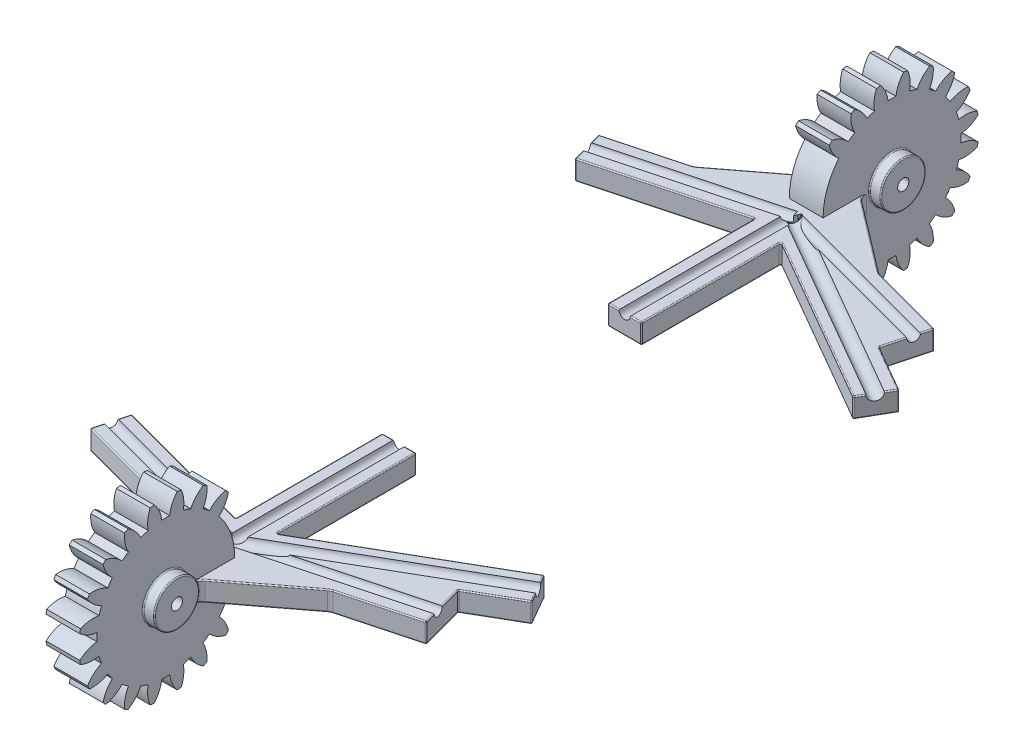
from build123d import *

# Parameters (mm, degrees)
BASPROSKE_W         = 3
BASPROSKE_H         = 7.7
TOOTHCUT_DEPTH      = 12.295131695
TEETHCUTS_COUNT     = 20
TEETHCUTS_ANGLE     = 342
BORSKE_R            = 0.5
BORE_DEPTH          = 50.0000508
CUT_EXTRUDE_1_DEPTH = 12.201503695
EXTRUDE_1_DEPTH     = 1.75
EXTRUDE_3_DEPTH     = 3
EXTRUDE_5_DEPTH     = 1.75
FILLET_4_R          = 0.1
FILLET_6_R          = 1
FILLET_7_R          = 1
FILLET_8_R          = 1
FILLET_9_R          = 0.1
FILLET_10_R         = 0.1
SKETCH_14_R         = 2
SKETCH_14_R_2       = 0.5
EXTRUDE_7_DEPTH     = 1
EXTRUDE_START       = 1
SKETCH_15_R         = 2
SKETCH_15_R_2       = 0.5
EXTRUDE_8_DEPTH     = 1
FILLET_11_R         = 0.1
FILLET_12_R         = 0.1
FILLET_13_R         = 0.1
SKETCH_9_R          = 0.5
CUT_EXTRUDE_2_DEPTH = 15
SKETCH_10_R         = 0.5
CUT_EXTRUDE_3_DEPTH = 15
SKETCH_16_R         = 0.6
CUT_EXTRUDE_4_DEPTH = 20
SKETCH_17_R         = 0.5
CUT_EXTRUDE_5_DEPTH = 15
FILLET_14_R         = 0.1


with BuildPart() as part:
    # BasProSke → Base-Revolve (revolve)
    with BuildSketch(Plane(origin=(0, 0, 0), x_dir=(1, 0, 0), z_dir=(0, 1, 0)), mode=Mode.PRIVATE) as base_revolve_sk:
        with Locations((1.5, 3.85)):
            Rectangle(BASPROSKE_W, BASPROSKE_H)
    revolve(base_revolve_sk.sketch.rotate(Axis((-10, 0, 0), (1, 0, 0)), 180), axis=Axis((-10, 0, 0), (1, 0, 0)))

    # TooCutSke → ToothCut (cut, through all)
    with BuildSketch(Plane(origin=(0, 0, 0), x_dir=(0, 0, -1), z_dir=(1, 0, 0))):
        with BuildLine():
            ThreePointArc((0.350524468, 6.11396014), (0, 6.124), (-0.350524468, 6.11396014))
            ThreePointArc((-0.350524468, 6.11396014), (-0.579534642, 6.937844235), (-1.04652851, 7.654187301))
            ThreePointArc((-1.04652851, 7.654187301), (0, 7.7254), (1.04652851, 7.654187301))
            ThreePointArc((1.04652851, 7.654187301), (0.579534642, 6.937844235), (0.350524468, 6.11396014))
        make_face()
    toothcut = extrude(amount=TOOTHCUT_DEPTH, mode=Mode.SUBTRACT)

    # TeethCuts: ToothCut ×20 about axis
    teethcuts_axis = Axis((-10, 0, 0), (1, 0, 0))
    for i in range(1, TEETHCUTS_COUNT):
        add(toothcut.rotate(teethcuts_axis, i * TEETHCUTS_ANGLE / (TEETHCUTS_COUNT - 1)), mode=Mode.SUBTRACT)

    # BorSke → Bore (cut, symmetric)
    with BuildSketch(Plane(origin=(0, 0, 0), x_dir=(0, 0, -1), z_dir=(1, 0, 0))):
        with Locations(Location((0, 0, 0), (0, 0, 180))):
            Circle(BORSKE_R)
    extrude(amount=BORE_DEPTH, both=True, mode=Mode.SUBTRACT)

    # 草图1 → 切除-拉伸1 (cut, through all)
    with BuildSketch(Plane(origin=(3, 0, 0), x_dir=(0, 0, -1), z_dir=(1, 0, 0))):
        with BuildLine():
            Line((4.954420074, 3.599596885), (6.32952333, 4.598667881))
            ThreePointArc((6.32952333, 4.598667881), (7.80058054, 0), (6.32952333, -4.598667881))
            Line((6.32952333, -4.598667881), (4.954420074, -3.599596885))
            ThreePointArc((4.954420074, -3.599596885), (6.124, 0), (4.954420074, 3.599596885))
        make_face()
    extrude(amount=-CUT_EXTRUDE_1_DEPTH, mode=Mode.SUBTRACT)

    # 草图3 → 凸台-拉伸1 (add)
    with BuildSketch(Plane(origin=(0, 0, 0), x_dir=(1, 0, 0), z_dir=(0, 1, 0))):
        Polygon((0, 6.093222374), (3, 6.093222374), (3, 6.094937651), (16.444767752, 9.697452313), (15.413748512, 13.545268498), (19.570508076, 15.945174751), (18.070508076, 18.543250962), (3, 9.842289068), (3, 22.244212856), (0, 22.244212856), (0, 9.199050916), (-12.600658827, 12.575387272), (-13.377115962, 9.677609793), align=None)
    extrude(amount=-EXTRUDE_1_DEPTH)

    # 草图4 → 凸台-拉伸3 (add)
    with BuildSketch(Plane.ZY):
        with BuildLine():
            Line((-6.093222374, 0), (-6.093222374, -1.75))
            Line((-6.093222374, -1.75), (-5.657265567, -2.344935458))
            ThreePointArc((-5.657265567, -2.344935458), (-5.880404131, -1.173427076), (-6.093222374, 0))
        make_face()
    extrude(amount=-EXTRUDE_3_DEPTH)

    # 草图6 → 凸台-拉伸5 (add)
    with BuildSketch(Plane(origin=(0, 0, 0), x_dir=(1, 0, 0), z_dir=(0, 1, 0))):
        Polygon((9.722383876, 7.896194982), (3, 2.778448376), (3, 6.094937651), align=None)
        Polygon((0, 2.778448376), (-6.688557981, 7.885416084), (0, 6.093222374), align=None)
    extrude(amount=-EXTRUDE_5_DEPTH)

    # 圆角4
    fillet_4_edges = [part.edges().sort_by_distance(p)[0] for p in [
        (15.929258132, 0, -11.621360405),
        (17.492128294, 0, -14.745221624),
        (18.820508076, 0, -17.244212856),
        (1.5, 0, -22.244212856),
        (-12.988887394, 0, -11.126498533),
        (-12.600658827, -0.875, -12.575387272),
        (1.5, -1.75, -22.244212856),
        (0, -0.875, -22.244212856),
        (3, -0.875, -22.244212856),
        (18.820508076, -1.75, -17.244212856),
        (18.070508076, -0.875, -18.543250962),
        (17.492128294, -1.75, -14.745221624),
        (19.570508076, -0.875, -15.945174751),
        (15.929258132, -1.75, -11.621360405),
        (15.413748512, -0.875, -13.545268498),
        (16.444767752, -0.875, -9.697452313),
        (-12.988887394, -1.75, -11.126498533),
        (-13.377115962, -0.875, -9.677609793),
    ]]
    fillet(fillet_4_edges, radius=FILLET_4_R)

    # 圆角6
    fillet_6_edges = [part.edges().sort_by_distance(p)[0] for p in [
        (9.722383876, -0.875, -7.896194982),
    ]]
    fillet(fillet_6_edges, radius=FILLET_6_R)

    # 圆角7
    fillet_7_edges = [part.edges().sort_by_distance(p)[0] for p in [
        (3, -0.875, -2.778448376),
    ]]
    fillet(fillet_7_edges, radius=FILLET_7_R)

    # 圆角8
    fillet_8_edges = [part.edges().sort_by_distance(p)[0] for p in [
        (0, -0.875, -2.778448376),
        (-6.688557981, -0.875, -7.885416084),
    ]]
    fillet(fillet_8_edges, radius=FILLET_8_R)

    # 圆角9
    # the kernel refuses this fillet: 0.1 mm, written as the material it takes off along each edge
    with BuildSketch(Plane(origin=(-13.254641475, -1.65, -9.748320472), x_dir=(-0.25881904510251724, 0, 0.9659258262890693), z_dir=(0, -1, 0))) as fillet_9_piece_1_section:
        Polygon((0, 0), (FILLET_9_R * 1.02, 0), (FILLET_9_R * 1.02, FILLET_9_R * 1.02), (0, FILLET_9_R * 1.02), align=None)
    fillet_9_piece_1 = extrude(amount=FILLET_9_R * 1.02, mode=Mode.PRIVATE)
    fillet_9_piece_1 = fillet_9_piece_1 - Plane(origin=(-13.254641475, -1.65, -9.748320472), x_dir=(0.8660254037844369, 0, -0.500000000000003), z_dir=(0, -1, 0)) * Sphere(FILLET_9_R, mode=Mode.PRIVATE)
    add(fillet_9_piece_1, mode=Mode.SUBTRACT)
    with BuildSketch(Plane(origin=(-13.254641475, -0.1, -9.748320472), x_dir=(-0.25881904510251724, 0, 0.9659258262890693), z_dir=(0, 1, 0))) as fillet_9_piece_2_section:
        Polygon((0, 0), (FILLET_9_R * 1.02, 0), (FILLET_9_R * 1.02, -FILLET_9_R * 1.02), (0, -FILLET_9_R * 1.02), align=None)
    fillet_9_piece_2 = extrude(amount=FILLET_9_R * 1.02, mode=Mode.PRIVATE)
    fillet_9_piece_2 = fillet_9_piece_2 - Plane(origin=(-13.254641475, -0.1, -9.748320472), x_dir=(0.8660254037844369, 0, -0.500000000000003), z_dir=(0, 1, 0)) * Sphere(FILLET_9_R, mode=Mode.PRIVATE)
    add(fillet_9_piece_2, mode=Mode.SUBTRACT)
    with BuildSketch(Plane(origin=(-13.280523379, -1.75, -9.651727889), x_dir=(0.2588190451025172, 0, -0.9659258262890692), z_dir=(0.9659258262890693, 0, 0.25881904510251724))) as fillet_9_piece_3:
        with BuildLine():
            CenterArc((FILLET_9_R, FILLET_9_R), FILLET_9_R, 180, 90)
            Line((0, FILLET_9_R), (0, 0))
            Line((0, 0), (FILLET_9_R, 0))
        make_face()
    extrude(amount=6.626833982, mode=Mode.SUBTRACT)
    with BuildSketch(Plane(origin=(-13.280523379, 0, -9.651727889), x_dir=(0.2588190451025172, 0, -0.9659258262890692), z_dir=(0.9659258262890693, 0, 0.25881904510251724))) as fillet_9_piece_4:
        with BuildLine():
            CenterArc((FILLET_9_R, -FILLET_9_R), FILLET_9_R, 90, 90)
            Line((0, -FILLET_9_R), (0, 0))
            Line((0, 0), (FILLET_9_R, 0))
        make_face()
    extrude(amount=6.626833982, mode=Mode.SUBTRACT)
    with BuildSketch(Plane(origin=(-0.393135816, 0, -3.078622483), x_dir=(0.6068641836157859, 0, -0.7948055502098269), z_dir=(-0.7948055502098269, 0, -0.606864183615786))) as fillet_9_piece_5:
        with BuildLine():
            CenterArc((FILLET_9_R, FILLET_9_R), FILLET_9_R, 180, 90)
            Line((0, FILLET_9_R), (0, 0))
            Line((0, 0), (FILLET_9_R, 0))
        make_face()
    extrude(amount=7.723036575, mode=Mode.SUBTRACT)
    with BuildSketch(Plane(origin=(-0.393135816, -1.75, -3.078622483), x_dir=(0.6068641836157859, 0, -0.7948055502098269), z_dir=(-0.7948055502098269, 0, -0.606864183615786))) as fillet_9_piece_6:
        with BuildLine():
            CenterArc((FILLET_9_R, -FILLET_9_R), FILLET_9_R, 90, 90)
            Line((0, -FILLET_9_R), (0, 0))
            Line((0, 0), (FILLET_9_R, 0))
        make_face()
    extrude(amount=7.723036575, mode=Mode.SUBTRACT)
    with BuildSketch(Plane(origin=(-7.138312334, 0, -6.970651219), x_dir=(0.2588190451025182, 0, -0.965925826289069), z_dir=(-0.965925826289069, 0, -0.2588190451025182))) as fillet_9_piece_7:
        with BuildLine():
            CenterArc((1 + FILLET_9_R, FILLET_9_R), FILLET_9_R, 180, 90)
            Line((1, FILLET_9_R), (1, 0))
            Line((1, 0), (1 + FILLET_9_R, 0))
        make_face()
    revolve(axis=Axis((-7.138312334, 0, -6.970651219), (0, -1, 0)), revolution_arc=22.363106768, mode=Mode.SUBTRACT)
    with BuildSketch(Plane(origin=(-7.138312334, -1.75, -6.970651219), x_dir=(0.2588190451025182, 0, -0.965925826289069), z_dir=(-0.965925826289069, 0, -0.2588190451025182))) as fillet_9_piece_8:
        with BuildLine():
            CenterArc((1 + FILLET_9_R, -FILLET_9_R), FILLET_9_R, 90, 90)
            Line((1, -FILLET_9_R), (1, 0))
            Line((1, 0), (1 + FILLET_9_R, 0))
        make_face()
    revolve(axis=Axis((-7.138312334, -1.75, -6.970651219), (0, -1, 0)), revolution_arc=22.363106768, mode=Mode.SUBTRACT)
    with BuildSketch(Plane(origin=(-1, 0, -2.283816933), x_dir=(0.6068641836157861, 0, -0.7948055502098269), z_dir=(-0.7948055502098269, 0, -0.6068641836157861))) as fillet_9_piece_9_section:
        with BuildLine():
            CenterArc((1 + FILLET_9_R, FILLET_9_R), FILLET_9_R, 180, 90)
            Line((1, FILLET_9_R), (1, 0))
            Line((1, 0), (1 + FILLET_9_R, 0))
        make_face()
    fillet_9_piece_9 = revolve(axis=Axis((-1, 0, -2.283816933), (0, -1, 0)), revolution_arc=66.962805944, mode=Mode.PRIVATE)
    fillet_9_piece_9 = split(fillet_9_piece_9, bisect_by=Plane(origin=(0, -0.016628304, -3.022660808), z_dir=(-1, 0, 0)), keep=Keep.TOP, mode=Mode.PRIVATE)
    add(fillet_9_piece_9, mode=Mode.SUBTRACT)
    with BuildSketch(Plane(origin=(-1, -1.75, -2.283816933), x_dir=(0.6068641836157861, 0, -0.7948055502098269), z_dir=(-0.7948055502098269, 0, -0.6068641836157861))) as fillet_9_piece_10_section:
        with BuildLine():
            CenterArc((1 + FILLET_9_R, -FILLET_9_R), FILLET_9_R, 90, 90)
            Line((1 + FILLET_9_R, 0), (1, 0))
            Line((1, 0), (1, -FILLET_9_R))
        make_face()
    fillet_9_piece_10 = revolve(axis=Axis((-1, -1.75, -2.283816933), (0, -1, 0)), revolution_arc=66.962805944, mode=Mode.PRIVATE)
    fillet_9_piece_10 = split(fillet_9_piece_10, bisect_by=Plane(origin=(0, -1.723986753, -2.727434684), z_dir=(-1, 0, 0)), keep=Keep.TOP, mode=Mode.PRIVATE)
    add(fillet_9_piece_10, mode=Mode.SUBTRACT)

    # 圆角10
    # the kernel refuses this fillet: 0.1 mm, written as the material it takes off along each edge
    with BuildSketch(Plane(origin=(16.322293264, -0.1, -9.768162991), x_dir=(0.25881904510251824, 0, 0.965925826289069), z_dir=(0, 1, 0))) as fillet_10_piece_1_section:
        Polygon((0, 0), (FILLET_10_R * 1.02, 0), (FILLET_10_R * 1.02, FILLET_10_R * 1.02), (0, FILLET_10_R * 1.02), align=None)
    fillet_10_piece_1 = extrude(amount=FILLET_10_R * 1.02, mode=Mode.PRIVATE)
    fillet_10_piece_1 = fillet_10_piece_1 - Plane(origin=(16.322293264, -0.1, -9.768162991), x_dir=(-0.8660254037844374, 0, -0.5000000000000022), z_dir=(0, 1, 0)) * Sphere(FILLET_10_R, mode=Mode.PRIVATE)
    add(fillet_10_piece_1, mode=Mode.SUBTRACT)
    with BuildSketch(Plane(origin=(16.322293264, -1.65, -9.768162991), x_dir=(0.25881904510251824, 0, 0.965925826289069), z_dir=(0, -1, 0))) as fillet_10_piece_2_section:
        Polygon((0, 0), (FILLET_10_R * 1.02, 0), (FILLET_10_R * 1.02, -FILLET_10_R * 1.02), (0, -FILLET_10_R * 1.02), align=None)
    fillet_10_piece_2 = extrude(amount=FILLET_10_R * 1.02, mode=Mode.PRIVATE)
    fillet_10_piece_2 = fillet_10_piece_2 - Plane(origin=(16.322293264, -1.65, -9.768162991), x_dir=(-0.8660254037844374, 0, -0.5000000000000022), z_dir=(0, -1, 0)) * Sphere(FILLET_10_R, mode=Mode.PRIVATE)
    add(fillet_10_piece_2, mode=Mode.SUBTRACT)
    with BuildSketch(Plane(origin=(9.912608856, -1.75, -7.947165612), x_dir=(-0.25881904510251824, 0, -0.965925826289069), z_dir=(0.965925826289069, 0, -0.25881904510251824))) as fillet_10_piece_3:
        with BuildLine():
            CenterArc((FILLET_10_R, FILLET_10_R), FILLET_10_R, 180, 90)
            Line((0, FILLET_10_R), (0, 0))
            Line((0, 0), (FILLET_10_R, 0))
        make_face()
    extrude(amount=6.662588511, mode=Mode.SUBTRACT)
    with BuildSketch(Plane(origin=(9.912608856, 0, -7.947165612), x_dir=(-0.25881904510251824, 0, -0.965925826289069), z_dir=(0.965925826289069, 0, -0.25881904510251824))) as fillet_10_piece_4:
        with BuildLine():
            CenterArc((FILLET_10_R, -FILLET_10_R), FILLET_10_R, 90, 90)
            Line((0, -FILLET_10_R), (0, 0))
            Line((0, 0), (FILLET_10_R, 0))
        make_face()
    extrude(amount=6.662588511, mode=Mode.SUBTRACT)
    with BuildSketch(Plane(origin=(10.171427901, 0, -6.981239785), x_dir=(-0.25881904510251985, 0, -0.9659258262890686), z_dir=(0.9659258262890686, 0, -0.25881904510251985))) as fillet_10_piece_5:
        with BuildLine():
            CenterArc((1 + FILLET_10_R, -FILLET_10_R), FILLET_10_R, 90, 90)
            Line((1, -FILLET_10_R), (1, 0))
            Line((1, 0), (1 + FILLET_10_R, 0))
        make_face()
    revolve(axis=Axis((10.171427901, 0, -6.981239785), (0, 1, 0)), revolution_arc=22.281995361, mode=Mode.SUBTRACT)
    with BuildSketch(Plane(origin=(10.171427901, -1.75, -6.981239785), x_dir=(-0.25881904510251985, 0, -0.9659258262890686), z_dir=(0.9659258262890686, 0, -0.25881904510251985))) as fillet_10_piece_6:
        with BuildLine():
            CenterArc((1 + FILLET_10_R, FILLET_10_R), FILLET_10_R, 180, 90)
            Line((1, FILLET_10_R), (1, 0))
            Line((1, 0), (1 + FILLET_10_R, 0))
        make_face()
    revolve(axis=Axis((10.171427901, -1.75, -6.981239785), (0, 1, 0)), revolution_arc=22.281995361, mode=Mode.SUBTRACT)
    with BuildSketch(Plane(origin=(9.565689501, -1.75, -7.776903653), x_dir=(-0.6057384005827819, 0, -0.7956638675090212), z_dir=(-0.7956638675090212, 0, 0.605738400582782))) as fillet_10_piece_7:
        with BuildLine():
            CenterArc((FILLET_10_R, -FILLET_10_R), FILLET_10_R, 90, 90)
            Line((0, -FILLET_10_R), (0, 0))
            Line((0, 0), (FILLET_10_R, 0))
        make_face()
    extrude(amount=7.756325445, mode=Mode.SUBTRACT)
    with BuildSketch(Plane(origin=(9.565689501, 0, -7.776903653), x_dir=(-0.6057384005827819, 0, -0.7956638675090212), z_dir=(-0.7956638675090212, 0, 0.605738400582782))) as fillet_10_piece_8:
        with BuildLine():
            CenterArc((FILLET_10_R, FILLET_10_R), FILLET_10_R, 180, 90)
            Line((0, FILLET_10_R), (0, 0))
            Line((0, 0), (FILLET_10_R, 0))
        make_face()
    extrude(amount=7.756325445, mode=Mode.SUBTRACT)
    with BuildSketch(Plane(origin=(4, 0, -2.282935616), x_dir=(-0.6057384005827823, 0, -0.795663867509021), z_dir=(0.795663867509021, 0, -0.6057384005827823))) as fillet_10_piece_9_section:
        with BuildLine():
            CenterArc((1 + FILLET_10_R, -FILLET_10_R), FILLET_10_R, 90, 90)
            Line((1, -FILLET_10_R), (1, 0))
            Line((1, 0), (1 + FILLET_10_R, 0))
        make_face()
    fillet_10_piece_9 = revolve(axis=Axis((4, 0, -2.282935616), (0, 1, 0)), revolution_arc=67.043923421, mode=Mode.PRIVATE)
    fillet_10_piece_9 = split(fillet_10_piece_9, bisect_by=Plane(origin=(3, -0.016628302, -3.02279015), z_dir=(1, 0, 0)), keep=Keep.TOP, mode=Mode.PRIVATE)
    add(fillet_10_piece_9, mode=Mode.SUBTRACT)
    with BuildSketch(Plane(origin=(4, -1.75, -2.282935616), x_dir=(-0.6057384005827823, 0, -0.795663867509021), z_dir=(0.795663867509021, 0, -0.6057384005827823))) as fillet_10_piece_10_section:
        with BuildLine():
            CenterArc((1 + FILLET_10_R, FILLET_10_R), FILLET_10_R, 180, 90)
            Line((1, FILLET_10_R), (1, 0))
            Line((1, 0), (1 + FILLET_10_R, 0))
        make_face()
    fillet_10_piece_10 = revolve(axis=Axis((4, -1.75, -2.282935616), (0, 1, 0)), revolution_arc=67.043923421, mode=Mode.PRIVATE)
    fillet_10_piece_10 = split(fillet_10_piece_10, bisect_by=Plane(origin=(3, -1.733371698, -3.02279015), z_dir=(1, 0, 0)), keep=Keep.TOP, mode=Mode.PRIVATE)
    add(fillet_10_piece_10, mode=Mode.SUBTRACT)

    # 草图14 → 凸台-拉伸7 (add)
    with BuildSketch(Plane.ZY):
        with Locations(Location((0, 0, 0), (0, 0, 180))):
            Circle(SKETCH_14_R)
        Circle(SKETCH_14_R_2, mode=Mode.SUBTRACT)
    extrude(amount=EXTRUDE_7_DEPTH)

    # 草图15 → 凸台-拉伸8 (add)
    with BuildSketch(Plane(origin=(3, 0, 0), x_dir=(0, 0, -1), z_dir=(1, 0, 0)).offset(EXTRUDE_START)):
        Circle(SKETCH_15_R)
        with Locations(Location((0, 0, 0), (0, 0, 180))):
            Circle(SKETCH_15_R_2, mode=Mode.SUBTRACT)
    extrude(amount=-EXTRUDE_8_DEPTH)

    # 圆角11
    fillet_11_edges = [part.edges().sort_by_distance(p)[0] for p in [
        (4, 0, 2),
    ]]
    fillet(fillet_11_edges, radius=FILLET_11_R)

    # 圆角12
    fillet_12_edges = [part.edges().sort_by_distance(p)[0] for p in [
        (0, 0, 2),
        (-1, 0, 2),
    ]]
    fillet(fillet_12_edges, radius=FILLET_12_R)

    # 圆角13
    fillet_13_edges = [part.edges().sort_by_distance(p)[0] for p in [
        (3, 0, 2),
    ]]
    fillet(fillet_13_edges, radius=FILLET_13_R)

    # 草图9 → 切除-拉伸2 (cut)
    with BuildSketch(Plane(origin=(0, 0, -22.244212856), x_dir=(-1, 0, 0), z_dir=(0, 0, -1))):
        with Locations((-1.5, 0)):
            Circle(SKETCH_9_R)
    extrude(amount=-CUT_EXTRUDE_2_DEPTH, mode=Mode.SUBTRACT)

    # 草图10 → 切除-拉伸3 (cut)
    with BuildSketch(Plane(origin=(-14.900421556, 0, -3.992555923), x_dir=(-0.25881904510251746, 0, 0.9659258262890692), z_dir=(-0.9659258262890692, 0, -0.25881904510251746))):
        with Locations((-7.385600857, 0)):
            Circle(SKETCH_10_R)
    extrude(amount=-CUT_EXTRUDE_3_DEPTH, mode=Mode.SUBTRACT)

    # 草图16 → 切除-拉伸4 (cut)
    with BuildSketch(Plane(origin=(21.582344258, 0, -12.460572267), x_dir=(-0.4999999999999981, 0, -0.8660254037844397), z_dir=(0.8660254037844397, 0, -0.4999999999999981))):
        with Locations((5.573672364, 0)):
            Circle(SKETCH_16_R)
    extrude(amount=-CUT_EXTRUDE_4_DEPTH, mode=Mode.SUBTRACT)

    # 草图17 → 切除-拉伸5 (cut)
    with BuildSketch(Plane(origin=(17.76754027, 0, -4.760798067), x_dir=(-0.2588190451025179, 0, -0.9659258262890691), z_dir=(0.9659258262890691, 0, -0.2588190451025179))):
        with Locations((6.610800551, 0)):
            Circle(SKETCH_17_R)
    extrude(amount=-CUT_EXTRUDE_5_DEPTH, mode=Mode.SUBTRACT)

    # 圆角14
    # the kernel refuses this fillet: 0.1 mm, written as the material it adds along each edge
    with BuildSketch(Plane(origin=(0, 0, -9.199050916), x_dir=(0, 0, -1), z_dir=(0, -1, 0))) as fillet_14_piece_1:
        with BuildLine():
            CenterArc((FILLET_14_R * 1.30322537284, -FILLET_14_R), FILLET_14_R, 90, 105)
            Line((FILLET_14_R * 0.337299546552, -FILLET_14_R * 1.2588190451), (0, 0))
            Line((0, 0), (FILLET_14_R * 1.30322537284, 0))
        make_face()
    extrude(amount=1.75)
    with BuildSketch(Plane(origin=(3, 0, -9.842289068), x_dir=(0.8660254037844408, 0, -0.499999999999996), z_dir=(0, -1, 0))) as fillet_14_piece_2:
        with BuildLine():
            CenterArc((FILLET_14_R * 1.73205080757, -FILLET_14_R), FILLET_14_R, 90, 120)
            Line((FILLET_14_R * 0.866025403784, -FILLET_14_R * 1.5), (0, 0))
            Line((0, 0), (FILLET_14_R * 1.73205080757, 0))
        make_face()
    extrude(amount=1.75)
    # the kernel refuses this fillet: 0.1 mm, written as the material it takes off along each edge
    with BuildSketch(Plane(origin=(18.033905535, -0.1, -18.406648422), x_dir=(0, 1, 0), z_dir=(-0.4999999999999984, 0, -0.8660254037844396))) as fillet_14_2_piece_1_section:
        Polygon((0, 0), (FILLET_14_R, 0), (FILLET_14_R, FILLET_14_R), (0, FILLET_14_R), align=None)
    fillet_14_2_piece_1 = extrude(amount=FILLET_14_R, mode=Mode.PRIVATE)
    fillet_14_2_piece_1 = fillet_14_2_piece_1 - Plane(origin=(18.033905535, -0.1, -18.406648422), x_dir=(-0.6123724356957956, -0.7071067811865475, 0.35355339059327184), z_dir=(-0.4999999999999984, 0, -0.8660254037844396)) * Sphere(FILLET_14_R, mode=Mode.PRIVATE)
    add(fillet_14_2_piece_1, mode=Mode.SUBTRACT)
    with BuildSketch(Plane(origin=(18.033905535, -1.65, -18.406648422), x_dir=(-0.4999999999999984, 0, -0.8660254037844396), z_dir=(0, -1, 0))) as fillet_14_2_piece_2_section:
        Polygon((0, 0), (FILLET_14_R, 0), (FILLET_14_R, FILLET_14_R), (0, FILLET_14_R), align=None)
    fillet_14_2_piece_2 = extrude(amount=FILLET_14_R, mode=Mode.PRIVATE)
    fillet_14_2_piece_2 = fillet_14_2_piece_2 - Plane(origin=(18.033905535, -1.65, -18.406648422), x_dir=(-0.2588190451025232, 0, 0.9659258262890676), z_dir=(0, -1, 0)) * Sphere(FILLET_14_R, mode=Mode.PRIVATE)
    add(fillet_14_2_piece_2, mode=Mode.SUBTRACT)
    with BuildSketch(Plane(origin=(-12.529948149, -1.65, -12.452912785), x_dir=(0.2588190451025181, 0, -0.9659258262890691), z_dir=(0, -1, 0))) as fillet_14_2_piece_3_section:
        Polygon((0, 0), (FILLET_14_R, 0), (FILLET_14_R, -FILLET_14_R), (0, -FILLET_14_R), align=None)
    fillet_14_2_piece_3 = extrude(amount=FILLET_14_R, mode=Mode.PRIVATE)
    fillet_14_2_piece_3 = fillet_14_2_piece_3 - Plane(origin=(-12.529948149, -1.65, -12.452912785), x_dir=(0.5000000000000026, 0, 0.866025403784437), z_dir=(0, -1, 0)) * Sphere(FILLET_14_R, mode=Mode.PRIVATE)
    add(fillet_14_2_piece_3, mode=Mode.SUBTRACT)
    with BuildSketch(Plane(origin=(-12.529948149, -0.1, -12.452912785), x_dir=(0, 1, 0), z_dir=(0.2588190451025181, 0, -0.9659258262890691))) as fillet_14_2_piece_4_section:
        Polygon((0, 0), (FILLET_14_R, 0), (FILLET_14_R, -FILLET_14_R), (0, -FILLET_14_R), align=None)
    fillet_14_2_piece_4 = extrude(amount=FILLET_14_R, mode=Mode.PRIVATE)
    fillet_14_2_piece_4 = fillet_14_2_piece_4 - Plane(origin=(-12.529948149, -0.1, -12.452912785), x_dir=(0.68301270189222, -0.7071067811865475, 0.18301270189221705), z_dir=(0.2588190451025181, 0, -0.9659258262890691)) * Sphere(FILLET_14_R, mode=Mode.PRIVATE)
    add(fillet_14_2_piece_4, mode=Mode.SUBTRACT)
    with BuildSketch(Plane(origin=(2.9, -0.1, -22.144212856), x_dir=(0, 1, 0), z_dir=(1, 0, 0))) as fillet_14_2_piece_5_section:
        Polygon((0, 0), (FILLET_14_R, 0), (FILLET_14_R, -FILLET_14_R), (0, -FILLET_14_R), align=None)
    fillet_14_2_piece_5 = extrude(amount=FILLET_14_R, mode=Mode.PRIVATE)
    fillet_14_2_piece_5 = fillet_14_2_piece_5 - Plane(origin=(2.9, -0.1, -22.144212856), x_dir=(0, -0.7071067811865475, 0.7071067811865475), z_dir=(1, 0, 0)) * Sphere(FILLET_14_R, mode=Mode.PRIVATE)
    add(fillet_14_2_piece_5, mode=Mode.SUBTRACT)
    with BuildSketch(Plane(origin=(0.1, -0.1, -22.144212856), x_dir=(0, 1, 0), z_dir=(-1, 0, 0))) as fillet_14_2_piece_6_section:
        Polygon((0, 0), (FILLET_14_R, 0), (FILLET_14_R, FILLET_14_R), (0, FILLET_14_R), align=None)
    fillet_14_2_piece_6 = extrude(amount=FILLET_14_R, mode=Mode.PRIVATE)
    fillet_14_2_piece_6 = fillet_14_2_piece_6 - Plane(origin=(0.1, -0.1, -22.144212856), x_dir=(0, -0.7071067811865475, 0.7071067811865475), z_dir=(-1, 0, 0)) * Sphere(FILLET_14_R, mode=Mode.PRIVATE)
    add(fillet_14_2_piece_6, mode=Mode.SUBTRACT)
    with BuildSketch(Plane(origin=(2.9, -1.65, -22.144212856), x_dir=(1, 0, 0), z_dir=(0, -1, 0))) as fillet_14_2_piece_7_section:
        Polygon((0, 0), (FILLET_14_R, 0), (FILLET_14_R, -FILLET_14_R), (0, -FILLET_14_R), align=None)
    fillet_14_2_piece_7 = extrude(amount=FILLET_14_R, mode=Mode.PRIVATE)
    fillet_14_2_piece_7 = fillet_14_2_piece_7 - Plane(origin=(2.9, -1.65, -22.144212856), x_dir=(-0.7071067811865474, 0, 0.7071067811865477), z_dir=(0, -1, 0)) * Sphere(FILLET_14_R, mode=Mode.PRIVATE)
    add(fillet_14_2_piece_7, mode=Mode.SUBTRACT)
    with BuildSketch(Plane(origin=(0.1, -1.65, -22.144212856), x_dir=(-1, 0, 0), z_dir=(0, -1, 0))) as fillet_14_2_piece_8_section:
        Polygon((0, 0), (FILLET_14_R, 0), (FILLET_14_R, FILLET_14_R), (0, FILLET_14_R), align=None)
    fillet_14_2_piece_8 = extrude(amount=FILLET_14_R, mode=Mode.PRIVATE)
    fillet_14_2_piece_8 = fillet_14_2_piece_8 - Plane(origin=(0.1, -1.65, -22.144212856), x_dir=(0.7071067811865476, 0, 0.7071067811865475), z_dir=(0, -1, 0)) * Sphere(FILLET_14_R, mode=Mode.PRIVATE)
    add(fillet_14_2_piece_8, mode=Mode.SUBTRACT)
    with BuildSketch(Plane(origin=(3, 0, -10.015494148), x_dir=(0, -1, 0), z_dir=(0, 0, -1)), Plane(origin=(3, -1.75, -10.015494148), x_dir=(-1, 0, 0), z_dir=(0, 0, -1))) as fillet_14_2_piece_9:
        with BuildLine():
            CenterArc((FILLET_14_R, FILLET_14_R), FILLET_14_R, 180, 90)
            Line((0, FILLET_14_R), (0, 0))
            Line((0, 0), (FILLET_14_R, 0))
        make_face()
    extrude(amount=12.128718708, mode=Mode.SUBTRACT)
    with BuildSketch(Plane(origin=(-0.125881905, 0, -9.23278087), x_dir=(0, -1, 0), z_dir=(-0.9659258262890691, 0, -0.2588190451025181)), Plane(origin=(-0.125881905, -1.75, -9.23278087), x_dir=(-0.258819045102518, 0, 0.9659258262890691), z_dir=(-0.9659258262890691, 0, -0.2588190451025181)), Plane(origin=(0, -1.75, -22.144212856), x_dir=(1, 0, 0), z_dir=(0, 0, 1)), Plane(origin=(0, 0, -22.144212856), x_dir=(0, -1, 0), z_dir=(0, 0, 1))) as fillet_14_2_piece_10:
        with BuildLine():
            CenterArc((FILLET_14_R, FILLET_14_R), FILLET_14_R, 180, 90)
            Line((0, FILLET_14_R), (0, 0))
            Line((0, 0), (FILLET_14_R, 0))
        make_face()
    extrude(amount=12.814839403, mode=Mode.SUBTRACT)
    with BuildSketch(Plane(origin=(17.983905535, -1.75, -18.493250962), x_dir=(0.49999999999999845, 0, 0.8660254037844396), z_dir=(-0.8660254037844396, 0, 0.4999999999999984)), Plane(origin=(17.983905535, 0, -18.493250962), x_dir=(0, -1, 0), z_dir=(-0.8660254037844396, 0, 0.4999999999999984))) as fillet_14_2_piece_11:
        with BuildLine():
            CenterArc((FILLET_14_R, FILLET_14_R), FILLET_14_R, 180, 90)
            Line((0, FILLET_14_R), (0, 0))
            Line((0, 0), (FILLET_14_R, 0))
        make_face()
    extrude(amount=17.128718708, mode=Mode.SUBTRACT)
    with BuildSketch(Plane(origin=(-0.1, 0, -9.329373453), x_dir=(1, 0, 0), z_dir=(0, 0, -1))) as fillet_14_2_piece_12:
        with BuildLine():
            CenterArc((0.1 + FILLET_14_R, FILLET_14_R), FILLET_14_R, 180, 90)
            Line((0.1, FILLET_14_R), (0.1, 0))
            Line((0.1, 0), (0.1 + FILLET_14_R, 0))
        make_face()
    revolve(axis=Axis((-0.1, 0, -9.329373453), (0, -1, 0)), revolution_arc=105, mode=Mode.SUBTRACT)
    with BuildSketch(Plane(origin=(3.1, 0, -10.015494148), x_dir=(0.500000000000004, 0, 0.8660254037844363), z_dir=(0.8660254037844363, 0, -0.500000000000004))) as fillet_14_2_piece_13:
        with BuildLine():
            CenterArc((0.1 + FILLET_14_R, FILLET_14_R), FILLET_14_R, 180, 90)
            Line((0.1, FILLET_14_R), (0.1, 0))
            Line((0.1, 0), (0.1 + FILLET_14_R, 0))
        make_face()
    revolve(axis=Axis((3.1, 0, -10.015494148), (0, -1, 0)), revolution_arc=120, mode=Mode.SUBTRACT)
    with BuildSketch(Plane(origin=(3.1, -1.75, -10.015494148), x_dir=(0.500000000000004, 0, 0.8660254037844363), z_dir=(0.8660254037844363, 0, -0.500000000000004))) as fillet_14_2_piece_14:
        with BuildLine():
            CenterArc((0.1 + FILLET_14_R, -FILLET_14_R), FILLET_14_R, 90, 90)
            Line((0.1, -FILLET_14_R), (0.1, 0))
            Line((0.1, 0), (0.1 + FILLET_14_R, 0))
        make_face()
    revolve(axis=Axis((3.1, -1.75, -10.015494148), (0, -1, 0)), revolution_arc=120, mode=Mode.SUBTRACT)
    with BuildSketch(Plane(origin=(-0.1, -1.75, -9.329373453), x_dir=(1, 0, 0), z_dir=(0, 0, -1))) as fillet_14_2_piece_15:
        with BuildLine():
            CenterArc((0.1 + FILLET_14_R, -FILLET_14_R), FILLET_14_R, 90, 90)
            Line((0.1, -FILLET_14_R), (0.1, 0))
            Line((0.1, 0), (0.1 + FILLET_14_R, 0))
        make_face()
    revolve(axis=Axis((-0.1, -1.75, -9.329373453), (0, -1, 0)), revolution_arc=105, mode=Mode.SUBTRACT)


with BuildPart() as body_2:
    # 镜向8: mirrored copy
    add(part.part.mirror(Plane(origin=(0, 0, -32.244212856), x_dir=(1, 0, 0), z_dir=(0, 0, -1))))


solid = Compound([part.part, body_2.part])
